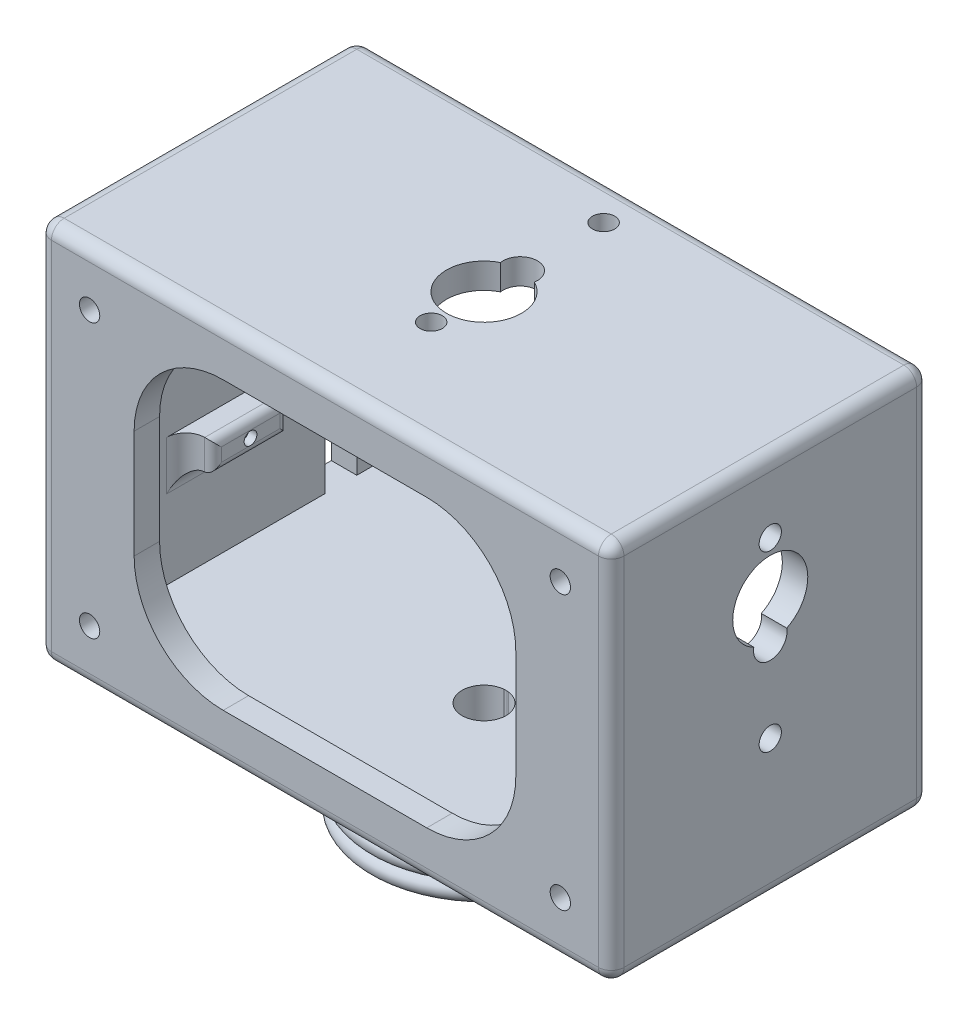
from build123d import *

# Parameters (mm, degrees)
CROQUIS1_W                 = 82
CROQUIS1_H                 = 52
SALIENTE_EXTRUIR1_DEPTH    = 4
CROQUIS1_4_W               = 4
CROQUIS1_4_H               = 52
SALIENTE_EXTRUIR2_DEPTH    = 50
CORTAR_EXTRUIR1_START      = -45
CROQUIS2_W                 = 5
CROQUIS2_H                 = 52
CORTAR_EXTRUIR1_DEPTH      = 88
REDONDEO1_R                = 2
CORTAR_EXTRUIR2_DEPTH      = 74.654599313
CORTAR_EXTRUIR2_DEPTH_BACK = 74.654599313
CROQUIS5_R                 = 1
SALIENTE_EXTRUIR4_START    = 41
CROQUIS5_4_W               = 11.8
CROQUIS5_4_H               = 4.7
CROQUIS5_4_R               = 1
SALIENTE_EXTRUIR4_DEPTH    = 4.3
SALIENTE_EXTRUIR5_START    = -41
CROQUIS5_5_W               = 11.8
CROQUIS5_5_H               = 4.7
CROQUIS5_5_R               = 1
SALIENTE_EXTRUIR5_DEPTH    = 4.3
REDONDEO3_R                = 3
REDONDEO4_R                = 1.3
CORTAR_EXTRUIR3_START      = 45
CROQUIS7_R                 = 1.75
CORTAR_EXTRUIR3_DEPTH      = 7
CORTAR_EXTRUIR4_START      = -38
CROQUIS7_3_R               = 1.75
CORTAR_EXTRUIR4_DEPTH      = 7
CORTAR_EXTRUIR5_START      = 30
CROQUIS8_R                 = 1
CROQUIS8_R_2               = 0.75
CORTAR_EXTRUIR5_DEPTH      = 4
SALIENTE_EXTRUIR6_START    = 26
CROQUIS8_3_W               = 11.8
CROQUIS8_3_H               = 4.7
CROQUIS8_3_R               = 0.75
CROQUIS8_3_R_2             = 1
SALIENTE_EXTRUIR6_DEPTH    = 4.3
REDONDEO5_R                = 3
REDONDEO6_R                = 1.3
CORTAR_EXTRUIR6_START      = 30
CROQUIS9_R                 = 1.75
CORTAR_EXTRUIR6_DEPTH      = 7
CORTAR_EXTRUIR7_REACH      = 75.655
CROQUIS11_R                = 1.6
CORTAR_EXTRUIR8_START      = -41.000003
CROQUIS16_R                = 1.5
CORTAR_EXTRUIR8_DEPTH      = 5.000001
CORTAR_EXTRUIR9_START      = -41.000003
CROQUIS16_3_R              = 1.5
CORTAR_EXTRUIR9_DEPTH      = 4.000001
CORTAR_EXTRUIR10_START     = -41.000003
CORTAR_EXTRUIR10_DEPTH     = 1.500001
CROQUIS18_R                = 1.5
CORTAR_EXTRUIR11_DEPTH     = 88.527138649
CORTAR_EXTRUIR12_START     = -36
CROQUIS16_5_R              = 1.5
CORTAR_EXTRUIR12_DEPTH     = 10


with BuildPart() as part:
    # Croquis1 → Saliente-Extruir1 (new body)
    with BuildSketch(Plane.XY):
        Rectangle(CROQUIS1_W, CROQUIS1_H)
    extrude(amount=-SALIENTE_EXTRUIR1_DEPTH)

    # Croquis1<4> → Saliente-Extruir2 (add)
    with BuildSketch(Plane.XY):
        Polygon((-45, 26), (-41, 26), (41, 26), (45, 26), (45, 30), (-45, 30), align=None)
        with Locations((-43, 0)):
            Rectangle(CROQUIS1_4_W, CROQUIS1_4_H)
        with Locations((43, 0)):
            Rectangle(CROQUIS1_4_W, CROQUIS1_4_H)
        Polygon((41, -26), (-41, -26), (-45, -26), (-45, -30), (45, -30), (45, -26), align=None)
    extrude(amount=-SALIENTE_EXTRUIR2_DEPTH)

    # Croquis2 → Cortar-Extruir1 (cut)
    with BuildSketch(Plane(origin=(0, 0, 0), x_dir=(0, 0, -1), z_dir=(1, 0, 0)).offset(CORTAR_EXTRUIR1_START)):
        with Locations((43.5, 0)):
            Rectangle(CROQUIS2_W, CROQUIS2_H)
    extrude(amount=CORTAR_EXTRUIR1_DEPTH, mode=Mode.SUBTRACT)

    # Redondeo1
    redondeo1_edges = [part.edges().sort_by_distance(p)[0] for p in [
        (-45, 0, -50),
        (-45, -30, -25),
        (0, 30, 0),
        (-45, 30, -25),
        (45, 0, 0),
        (45, 30, -25),
        (0, -30, -50),
        (45, -30, -25),
        (0, 30, -50),
        (45, 0, -50),
        (-45, 0, 0),
        (0, -30, 0),
    ]]
    fillet(redondeo1_edges, radius=REDONDEO1_R)

    # Croquis5 → Cortar-Extruir2 (cut, two sides: drawn at the far end of the back side and taken through both)
    with BuildSketch(Plane(origin=(0, 0, 0), x_dir=(0, 0, -1), z_dir=(1, 0, 0)).offset(-CORTAR_EXTRUIR2_DEPTH_BACK)):
        with Locations((25, 19)):
            Circle(CROQUIS5_R)
        with Locations((25, -8.3)):
            Circle(CROQUIS5_R)
        with BuildLine():
            ThreePointArc((27.590899517, 5.399317054), (25, 16.6), (22.409100483, 5.399317054))
            ThreePointArc((22.409100483, 5.399317054), (25, 2.3), (27.590899517, 5.399317054))
        make_face()
    extrude(amount=CORTAR_EXTRUIR2_DEPTH + CORTAR_EXTRUIR2_DEPTH_BACK, mode=Mode.SUBTRACT)

    # Croquis5<4> → Saliente-Extruir4 (add)
    # profile 1 of 2: a face of its own
    with BuildSketch(Plane(origin=(0, 0, 0), x_dir=(0, 0, -1), z_dir=(1, 0, 0)).offset(SALIENTE_EXTRUIR4_START)):
        with Locations((25, 18.95)):
            Rectangle(CROQUIS5_4_W, CROQUIS5_4_H)
        with Locations((25, 19)):
            Circle(CROQUIS5_4_R, mode=Mode.SUBTRACT)
    # profile 2 of 2: a face of its own
    with BuildSketch(Plane(origin=(0, 0, 0), x_dir=(0, 0, -1), z_dir=(1, 0, 0)).offset(SALIENTE_EXTRUIR4_START)):
        with Locations((25, -8.25)):
            Rectangle(CROQUIS5_4_W, CROQUIS5_4_H)
        with Locations((25, -8.3)):
            Circle(CROQUIS5_4_R, mode=Mode.SUBTRACT)
    extrude(amount=-SALIENTE_EXTRUIR4_DEPTH)

    # Croquis5<5> → Saliente-Extruir5 (add)
    # profile 1 of 2: a face of its own
    with BuildSketch(Plane(origin=(0, 0, 0), x_dir=(0, 0, -1), z_dir=(1, 0, 0)).offset(SALIENTE_EXTRUIR5_START)):
        with Locations((25, 18.95)):
            Rectangle(CROQUIS5_5_W, CROQUIS5_5_H)
        with Locations((25, 19)):
            Circle(CROQUIS5_5_R, mode=Mode.SUBTRACT)
    # profile 2 of 2: a face of its own
    with BuildSketch(Plane(origin=(0, 0, 0), x_dir=(0, 0, -1), z_dir=(1, 0, 0)).offset(SALIENTE_EXTRUIR5_START)):
        with Locations((25, -8.25)):
            Rectangle(CROQUIS5_5_W, CROQUIS5_5_H)
        with Locations((25, -8.3)):
            Circle(CROQUIS5_5_R, mode=Mode.SUBTRACT)
    extrude(amount=SALIENTE_EXTRUIR5_DEPTH)

    # Redondeo3
    redondeo3_edges = [part.edges().sort_by_distance(p)[0] for p in [
        (41, 21.3, -25),
        (41, 18.95, -19.1),
        (41, 18.95, -30.9),
        (41, -8.25, -30.9),
        (41, -10.6, -25),
        (41, -8.25, -19.1),
        (-41, 18.95, -30.9),
        (-41, 18.95, -19.1),
        (-41, 21.3, -25),
        (-41, -8.25, -19.1),
        (-41, -10.6, -25),
        (-41, -8.25, -30.9),
    ]]
    fillet(redondeo3_edges, radius=REDONDEO3_R)

    # Redondeo4
    redondeo4_edges = [part.edges().sort_by_distance(p)[0] for p in [
        (-36.7, 18.95, -30.9),
        (-36.7, -8.25, -30.9),
        (-36.7, -10.6, -25),
        (-36.7, -8.25, -19.1),
        (-36.7, -5.9, -25),
        (-36.7, 21.3, -25),
        (-36.7, 18.95, -19.1),
        (-36.7, 16.6, -25),
        (36.7, 18.95, -30.9),
        (36.7, 21.3, -25),
        (36.7, 16.6, -25),
        (36.7, 18.95, -19.1),
        (36.7, -8.25, -19.1),
        (36.7, -8.25, -30.9),
        (36.7, -10.6, -25),
        (36.7, -5.9, -25),
    ]]
    fillet(redondeo4_edges, radius=REDONDEO4_R - 0.0001)  # a hair under: the kernel refuses the full size

    # Croquis7 → Cortar-Extruir3 (cut)
    with BuildSketch(Plane(origin=(0, 0, 0), x_dir=(0, 0, -1), z_dir=(1, 0, 0)).offset(CORTAR_EXTRUIR3_START)):
        with Locations(Location((25, 19, 0), (0, 0, 180))):
            Circle(CROQUIS7_R)
        with Locations(Location((25, -8.3, 0), (0, 0, 180))):
            Circle(CROQUIS7_R)
    extrude(amount=-CORTAR_EXTRUIR3_DEPTH, mode=Mode.SUBTRACT)

    # Croquis7<3> → Cortar-Extruir4 (cut)
    with BuildSketch(Plane(origin=(0, 0, 0), x_dir=(0, 0, -1), z_dir=(1, 0, 0)).offset(CORTAR_EXTRUIR4_START)):
        with Locations(Location((25, 19, 0), (0, 0, 180))):
            Circle(CROQUIS7_3_R)
        with Locations(Location((25, -8.3, 0), (0, 0, 180))):
            Circle(CROQUIS7_3_R)
    extrude(amount=-CORTAR_EXTRUIR4_DEPTH, mode=Mode.SUBTRACT)

    # Croquis8 → Cortar-Extruir5 (cut)
    with BuildSketch(Plane(origin=(0, 0, 0), x_dir=(1, 0, 0), z_dir=(0, 1, 0)).offset(CORTAR_EXTRUIR5_START)):
        with Locations(Location((0, 16.7, 0), (0, 0, 270))):
            Circle(CROQUIS8_R)
        with Locations(Location((0, 43.8, 0), (0, 0, 270))):
            Circle(CROQUIS8_R_2)
        with BuildLine():
            ThreePointArc((-2.664570246, 30.264035088), (0, 19.1), (2.664570246, 30.264035088))
            ThreePointArc((2.664570246, 30.264035088), (0, 33.4), (-2.664570246, 30.264035088))
        make_face()
    extrude(amount=-CORTAR_EXTRUIR5_DEPTH, mode=Mode.SUBTRACT)

    # Croquis8<3> → Saliente-Extruir6 (add)
    # profile 1 of 2: a face of its own
    with BuildSketch(Plane(origin=(0, 0, 0), x_dir=(1, 0, 0), z_dir=(0, 1, 0)).offset(SALIENTE_EXTRUIR6_START)):
        with Locations((0, 43.75)):
            Rectangle(CROQUIS8_3_W, CROQUIS8_3_H)
        with Locations(Location((0, 43.8, 0), (0, 0, 270))):
            Circle(CROQUIS8_3_R, mode=Mode.SUBTRACT)
    # profile 2 of 2: a face of its own
    with BuildSketch(Plane(origin=(0, 0, 0), x_dir=(1, 0, 0), z_dir=(0, 1, 0)).offset(SALIENTE_EXTRUIR6_START)):
        with Locations((0, 16.75)):
            Rectangle(CROQUIS8_3_W, CROQUIS8_3_H)
        with Locations(Location((0, 16.7, 0), (0, 0, 270))):
            Circle(CROQUIS8_3_R_2, mode=Mode.SUBTRACT)
    extrude(amount=-SALIENTE_EXTRUIR6_DEPTH)

    # Redondeo5
    redondeo5_edges = [part.edges().sort_by_distance(p)[0] for p in [
        (5.9, 26, -43.75),
        (0, 26, -46.1),
        (-5.9, 26, -43.75),
        (5.9, 26, -16.75),
        (-5.9, 26, -16.75),
        (0, 26, -14.4),
    ]]
    fillet(redondeo5_edges, radius=REDONDEO5_R)

    # Redondeo6
    redondeo6_edges = [part.edges().sort_by_distance(p)[0] for p in [
        (5.9, 21.7, -43.75),
        (0, 21.7, -46.1),
        (-5.9, 21.7, -43.75),
        (5.9, 21.7, -16.75),
        (0, 21.7, -14.4),
        (-5.9, 21.7, -16.75),
        (0, 21.7, -19.1),
        (0, 21.7, -41.4),
    ]]
    fillet(redondeo6_edges, radius=REDONDEO6_R - 0.0001)  # a hair under: the kernel refuses the full size

    # Croquis9 → Cortar-Extruir6 (cut)
    with BuildSketch(Plane(origin=(0, 0, 0), x_dir=(1, 0, 0), z_dir=(0, 1, 0)).offset(CORTAR_EXTRUIR6_START)):
        with Locations((0, 43.8)):
            Circle(CROQUIS9_R)
        with Locations((0, 16.7)):
            Circle(CROQUIS9_R)
    extrude(amount=-CORTAR_EXTRUIR6_DEPTH, mode=Mode.SUBTRACT)

    # Croquis11 → Cortar-Extruir7 (cut, up to next)
    with BuildSketch(Plane.XY, mode=Mode.PRIVATE) as cortar_extruir7_sk1:
        with Locations((-37, -21.5)):
            Circle(CROQUIS11_R)
    cortar_extruir7_tool1 = extrude(cortar_extruir7_sk1.sketch, amount=-CORTAR_EXTRUIR7_REACH, mode=Mode.PRIVATE) & part.part
    # Croquis11 → Cortar-Extruir7 (cut, up to next)
    with BuildSketch(Plane.XY, mode=Mode.PRIVATE) as cortar_extruir7_sk2:
        with BuildLine():
            ThreePointArc((-30, 8.5), (-25.899494937, 18.399494937), (-16, 22.5))
            Line((-16, 22.5), (16, 22.5))
            ThreePointArc((16, 22.5), (25.899494937, 18.399494937), (30, 8.5))
            Line((30, 8.5), (30, -8.5))
            ThreePointArc((30, -8.5), (25.899494937, -18.399494937), (16, -22.5))
            Line((16, -22.5), (-16, -22.5))
            ThreePointArc((-16, -22.5), (-25.899494937, -18.399494937), (-30, -8.5))
            Line((-30, -8.5), (-30, 8.5))
        make_face()
    cortar_extruir7_tool2 = extrude(cortar_extruir7_sk2.sketch, amount=-CORTAR_EXTRUIR7_REACH, mode=Mode.PRIVATE) & part.part
    # Croquis11 → Cortar-Extruir7 (cut, up to next)
    with BuildSketch(Plane.XY, mode=Mode.PRIVATE) as cortar_extruir7_sk3:
        with Locations((-37, 21.5)):
            Circle(CROQUIS11_R)
    cortar_extruir7_tool3 = extrude(cortar_extruir7_sk3.sketch, amount=-CORTAR_EXTRUIR7_REACH, mode=Mode.PRIVATE) & part.part
    # Croquis11 → Cortar-Extruir7 (cut, up to next)
    with BuildSketch(Plane.XY, mode=Mode.PRIVATE) as cortar_extruir7_sk4:
        with Locations((37, 21.5)):
            Circle(CROQUIS11_R)
    cortar_extruir7_tool4 = extrude(cortar_extruir7_sk4.sketch, amount=-CORTAR_EXTRUIR7_REACH, mode=Mode.PRIVATE) & part.part
    # Croquis11 → Cortar-Extruir7 (cut, up to next)
    with BuildSketch(Plane.XY, mode=Mode.PRIVATE) as cortar_extruir7_sk5:
        with Locations((37, -21.5)):
            Circle(CROQUIS11_R)
    cortar_extruir7_tool5 = extrude(cortar_extruir7_sk5.sketch, amount=-CORTAR_EXTRUIR7_REACH, mode=Mode.PRIVATE) & part.part
    add(cortar_extruir7_tool1.solids().sort_by_distance((-37, -21.5, 0))[0], mode=Mode.SUBTRACT)
    add(cortar_extruir7_tool2.solids().sort_by_distance((0, 0, 0))[0], mode=Mode.SUBTRACT)
    add(cortar_extruir7_tool3.solids().sort_by_distance((-37, 21.5, 0))[0], mode=Mode.SUBTRACT)
    add(cortar_extruir7_tool4.solids().sort_by_distance((37, 21.5, 0))[0], mode=Mode.SUBTRACT)
    add(cortar_extruir7_tool5.solids().sort_by_distance((37, -21.5, 0))[0], mode=Mode.SUBTRACT)


with BuildPart() as revoluci_n2_tool:
    # Croquis14 → Revolución2 (revolve)
    with BuildSketch(Plane.XY.offset(-25)):
        with BuildLine():
            Line((0, -30.000002792), (16.611894613, -30.000002792))
            ThreePointArc((16.611894613, -30.000002792), (17.973525455, -31.398192966), (16.611894613, -32.79638314))
            ThreePointArc((16.611894613, -32.79638314), (18, -34.148192888), (16.611894613, -35.500002637))
            ThreePointArc((16.611894613, -35.500002637), (17.973525455, -36.89819281), (16.611894613, -38.296382984))
            ThreePointArc((16.611894613, -38.296382984), (18, -39.648192733), (16.611894613, -41.000002481))
            Line((16.611894613, -41.000002481), (0, -41.000002481))
            Line((0, -41.000002481), (0, -30.000002792))
        make_face()
    revolve(axis=Axis((0, -30.000002792, -25), (0, -1, 0)))


with BuildPart() as part_1:
    add(part.part)


with BuildPart() as part_2:
    # Revolución2: joined with revoluci_n2_tool
    add(part_1.part.fuse(revoluci_n2_tool.part, tol=0.00001))

    # Croquis16 → Cortar-Extruir8 (cut)
    with BuildSketch(Plane(origin=(0, 0, 0), x_dir=(1, 0, 0), z_dir=(0, 1, 0)).offset(CORTAR_EXTRUIR8_START)):
        with Locations(Location((0, 25, 0), (0, 0, 180))):
            Circle(CROQUIS16_R)
    extrude(amount=CORTAR_EXTRUIR8_DEPTH, mode=Mode.SUBTRACT)

    # Croquis16<3> → Cortar-Extruir9 (cut)
    with BuildSketch(Plane(origin=(0, 0, 0), x_dir=(1, 0, 0), z_dir=(0, 1, 0)).offset(CORTAR_EXTRUIR9_START)):
        with BuildLine():
            Line((-0.390551087, 21.572177098), (-0.210617461, 21.556434945))
            ThreePointArc((-0.210617461, 21.556434945), (0, 21.55), (0.210617461, 21.556434945))
            Line((0.210617461, 21.556434945), (0.390551087, 21.572177098))
            ThreePointArc((0.390551087, 21.572177098), (2.573897944, 22.702708252), (3.45, 25))
            ThreePointArc((3.45, 25), (2.573897944, 27.297291748), (0.390551087, 28.427822902))
            Line((0.390551087, 28.427822902), (0.210617461, 28.443565055))
            ThreePointArc((0.210617461, 28.443565055), (0, 28.45), (-0.210617461, 28.443565055))
            Line((-0.210617461, 28.443565055), (-0.390551087, 28.427822902))
            ThreePointArc((-0.390551087, 28.427822902), (-3.45, 25), (-0.390551087, 21.572177098))
        make_face()
        with Locations(Location((0, 25, 0), (0, 0, 180))):
            Circle(CROQUIS16_3_R, mode=Mode.SUBTRACT)
    extrude(amount=CORTAR_EXTRUIR9_DEPTH, mode=Mode.SUBTRACT)

    # Croquis16<4> → Cortar-Extruir10 (cut)
    with BuildSketch(Plane(origin=(0, 0, 0), x_dir=(1, 0, 0), z_dir=(0, 1, 0)).offset(CORTAR_EXTRUIR10_START)):
        with BuildLine():
            ThreePointArc((3.45, 25), (2.573897944, 22.702708252), (0.390551087, 21.572177098))
            Line((0.390551087, 21.572177098), (14.489251984, 22.805653597))
            ThreePointArc((14.489251984, 22.805653597), (16.5, 25), (14.489251984, 27.194346403))
            Line((14.489251984, 27.194346403), (0.390551087, 28.427822902))
            ThreePointArc((0.390551087, 28.427822902), (2.573897944, 27.297291748), (3.45, 25))
        make_face()
        with BuildLine():
            Line((-14.489251984, 22.805653597), (-0.390551087, 21.572177098))
            ThreePointArc((-0.390551087, 21.572177098), (-3.45, 25), (-0.390551087, 28.427822902))
            Line((-0.390551087, 28.427822902), (-14.489251984, 27.194346403))
            ThreePointArc((-14.489251984, 27.194346403), (-16.5, 25), (-14.489251984, 22.805653597))
        make_face()
    extrude(amount=CORTAR_EXTRUIR10_DEPTH, mode=Mode.SUBTRACT)

    # Croquis18 → Cortar-Extruir11 (cut, through all)
    with BuildSketch(Plane(origin=(0, -26, 0), x_dir=(1, 0, 0), z_dir=(0, 1, 0))):
        with Locations(Location((0, 25, 0), (0, 0, 180))):
            Circle(CROQUIS18_R)
    extrude(amount=-CORTAR_EXTRUIR11_DEPTH, mode=Mode.SUBTRACT)

    # Croquis16<5> → Cortar-Extruir12 (cut)
    with BuildSketch(Plane(origin=(0, 0, 0), x_dir=(1, 0, 0), z_dir=(0, 1, 0)).offset(CORTAR_EXTRUIR12_START)):
        with BuildLine():
            Line((-0.390551087, 21.572177098), (-0.210617461, 21.556434945))
            ThreePointArc((-0.210617461, 21.556434945), (0, 21.55), (0.210617461, 21.556434945))
            Line((0.210617461, 21.556434945), (0.390551087, 21.572177098))
            ThreePointArc((0.390551087, 21.572177098), (2.573897944, 22.702708252), (3.45, 25))
            ThreePointArc((3.45, 25), (2.573897944, 27.297291748), (0.390551087, 28.427822902))
            Line((0.390551087, 28.427822902), (0.210617461, 28.443565055))
            ThreePointArc((0.210617461, 28.443565055), (0, 28.45), (-0.210617461, 28.443565055))
            Line((-0.210617461, 28.443565055), (-0.390551087, 28.427822902))
            ThreePointArc((-0.390551087, 28.427822902), (-3.45, 25), (-0.390551087, 21.572177098))
        make_face()
        with Locations(Location((0, 25, 0), (0, 0, 90))):
            Circle(CROQUIS16_5_R, mode=Mode.SUBTRACT)
    extrude(amount=CORTAR_EXTRUIR12_DEPTH, mode=Mode.SUBTRACT)


solid = part_2.part
